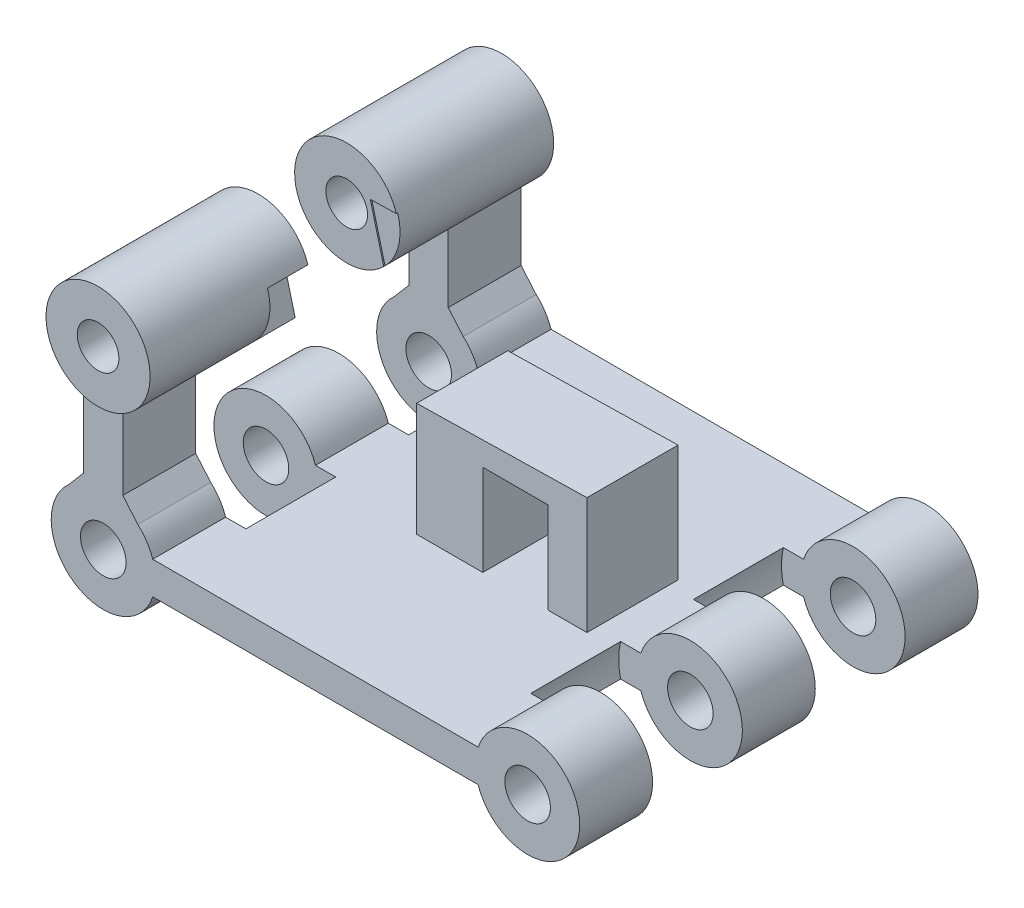
from build123d import *

# Parameters (mm, degrees)
SKETCH_2_R                   = 4
SKETCH_2_R_2                 = 1.75
EXTRUDE_1_DEPTH              = 5.6
PATTERN_LINEAR_1_COUNT       = 3
PATTERN_LINEAR_1_PITCH       = 12.5
EXTRUDE_2_DEPTH              = 6.25
EXTRUDE_2_DEPTH_BACK         = 37.25
SKETCH_3_W                   = 25
SKETCH_3_H                   = 2.5
SKETCH_4_R                   = 5.5
CUT_EXTRUDE_1_DEPTH          = 6.9
PATTERN_LINEAR_2_COUNT       = 4
PATTERN_LINEAR_2_PITCH       = 12.5
PATTERN_LINEAR_4_COUNT       = 2
PATTERN_LINEAR_4_PITCH       = 12.5
PATTERN_START                = 12.5
PATTERN_LINEAR_3_OUTLINE_R   = 1.75
PATTERN_LINEAR_3_DEPTH       = 5.6
PATTERN_START_2              = 25
PATTERN_LINEAR_3_2_OUTLINE_R = 1.75
PATTERN_LINEAR_3_2_DEPTH     = 5.6
MIRROR_3_COPY_1_SKETCH_R     = 5.5
MIRROR_3_COPY_1_DEPTH        = 6.9
MIRROR_3_COPY_2_SKETCH_R     = 5.5
MIRROR_3_COPY_2_DEPTH        = 6.9
MIRROR_3_COPY_3_SKETCH_R     = 5.5
MIRROR_3_COPY_3_DEPTH        = 6.9
MIRROR_3_COPY_4_SKETCH_R     = 5.5
MIRROR_3_COPY_4_DEPTH        = 6.9
SKETCH_5_W                   = 3
SKETCH_5_H                   = 10
EXTRUDE_3_DEPTH              = 5.6
EXTRUDE_4_DEPTH              = 25
EXTRUDE_4_DEPTH_BACK         = 6
SKETCH_6_R                   = 4
SKETCH_7_W                   = 20
SKETCH_7_H                   = 7
EXTRUDE_5_DEPTH              = 10
SKETCH_8_W                   = 5
SKETCH_8_H                   = 7
CUT_EXTRUDE_2_DEPTH          = 10
SKETCH_12_W                  = 25.926545396
SKETCH_12_H                  = 6.65
SKETCH_12_W_2                = 26.106427018
SKETCH_12_H_2                = 6.25
CUT_EXTRUDE_5_DEPTH          = 10
CUT_EXTRUDE_6_DEPTH          = 3.4
CUT_EXTRUDE_6_DEPTH_BACK     = 3.4
SKETCH_13_R                  = 4
SKETCH_14_R                  = 1.6
CUT_EXTRUDE_7_DEPTH          = 56.2


# Read off the part's stored shape, not the designer's step: Линейный массив3
with BuildPart() as part:
    # Эскиз2 → Бобышка-Вытянуть1 (new body)
    with BuildSketch(Plane.XY):
        Circle(SKETCH_2_R)
        Circle(SKETCH_2_R_2, mode=Mode.SUBTRACT)
    extrude_1 = extrude(amount=EXTRUDE_1_DEPTH)


with BuildPart() as pattern_linear_1_1:
    # Линейный массив1: pattern copy
    add(part.part.moved(Location(Vector(0, 0, 1) * (1 * PATTERN_LINEAR_1_PITCH))))


with BuildPart() as pattern_linear_1_2:
    # Линейный массив1: pattern copy
    add(part.part.moved(Location(Vector(0, 0, 1) * (2 * PATTERN_LINEAR_1_PITCH))))


with BuildPart() as part_1:
    add(part.part)

    add(pattern_linear_1_1.part)  # Бобышка-Вытянуть2 merges Линейный массив1_1

    add(pattern_linear_1_2.part)  # Бобышка-Вытянуть2 merges Линейный массив1_2
    # Эскиз3 → Бобышка-Вытянуть2 (add, two sides: drawn at the far end of the back side and taken through both)
    with BuildSketch(Plane(origin=(0, 0, 0), x_dir=(-1, 0, 0), z_dir=(0, 0, -1)).offset(-EXTRUDE_2_DEPTH_BACK)):
        with Locations((16.299671038, 0)):
            Rectangle(SKETCH_3_W, SKETCH_3_H)
    extrude(amount=EXTRUDE_2_DEPTH + EXTRUDE_2_DEPTH_BACK)

    # Эскиз4 → Вырез-Вытянуть1 (cut)
    with BuildSketch(Plane.XY.offset(5.6)):
        Circle(SKETCH_4_R)
    cut_extrude_1 = extrude(amount=CUT_EXTRUDE_1_DEPTH, mode=Mode.SUBTRACT)

    # Линейный массив2: Вырез-Вытянуть1 ×4
    with Locations(*[(0, 0, i * PATTERN_LINEAR_2_PITCH) for i in range(1, PATTERN_LINEAR_2_COUNT)]):
        add(cut_extrude_1, mode=Mode.SUBTRACT)

    # Линейный массив4: Вырез-Вытянуть1 ×2
    with Locations(*[(0, 0, -i * PATTERN_LINEAR_4_PITCH) for i in range(1, PATTERN_LINEAR_4_COUNT)]):
        add(cut_extrude_1, mode=Mode.SUBTRACT)

    # Зеркальное отражение1: Бобышка-Вытянуть1 across plane
    add(extrude_1.mirror(Plane.ZY.offset(16.299671038)))

    # Линейный массив3 outline → Линейный массив3 (add)
    with BuildSketch(Plane.XY.offset(PATTERN_START)):
        with BuildLine():
            ThreePointArc((-28.799671038, 1.25), (-36.599342077, 0), (-28.799671038, -1.25))
            Line((-28.799671038, -1.25), (-28.799671038, 1.25))
        make_face()
        with Locations((-32.599342077, 0)):
            Circle(PATTERN_LINEAR_3_OUTLINE_R, mode=Mode.SUBTRACT)
    extrude(amount=PATTERN_LINEAR_3_DEPTH)

    # Pattern Linear 3 2 outline → Pattern Linear 3 2 (add)
    with BuildSketch(Plane.XY.offset(PATTERN_START_2)):
        with BuildLine():
            ThreePointArc((-28.799671038, 1.25), (-36.599342077, 0), (-28.799671038, -1.25))
            Line((-28.799671038, -1.25), (-28.799671038, 1.25))
        make_face()
        with Locations((-32.599342077, 0)):
            Circle(PATTERN_LINEAR_3_2_OUTLINE_R, mode=Mode.SUBTRACT)
    extrude(amount=PATTERN_LINEAR_3_2_DEPTH)

    # Зеркальное отражение3: Вырез-Вытянуть1 across plane
    add(cut_extrude_1.mirror(Plane.ZY.offset(16.299671038)), mode=Mode.SUBTRACT)

    # Зеркальное отражение3 copy 1 sketch → Зеркальное отражение3 copy 1 (cut)
    with BuildSketch(Plane(origin=(-32.599342077, 0, 18.1), x_dir=(-1, 0, 0), z_dir=(0, 0, 1))):
        Circle(MIRROR_3_COPY_1_SKETCH_R)
    extrude(amount=MIRROR_3_COPY_1_DEPTH, mode=Mode.SUBTRACT)

    # Зеркальное отражение3 copy 2 sketch → Зеркальное отражение3 copy 2 (cut)
    with BuildSketch(Plane(origin=(-32.599342077, 0, 30.6), x_dir=(-1, 0, 0), z_dir=(0, 0, 1))):
        Circle(MIRROR_3_COPY_2_SKETCH_R)
    extrude(amount=MIRROR_3_COPY_2_DEPTH, mode=Mode.SUBTRACT)

    # Зеркальное отражение3 copy 3 sketch → Зеркальное отражение3 copy 3 (cut)
    with BuildSketch(Plane(origin=(-32.599342077, 0, 43.1), x_dir=(-1, 0, 0), z_dir=(0, 0, 1))):
        Circle(MIRROR_3_COPY_3_SKETCH_R)
    extrude(amount=MIRROR_3_COPY_3_DEPTH, mode=Mode.SUBTRACT)

    # Зеркальное отражение3 copy 4 sketch → Зеркальное отражение3 copy 4 (cut)
    with BuildSketch(Plane(origin=(-32.599342077, 0, -6.9), x_dir=(-1, 0, 0), z_dir=(0, 0, 1))):
        Circle(MIRROR_3_COPY_4_SKETCH_R)
    extrude(amount=MIRROR_3_COPY_4_DEPTH, mode=Mode.SUBTRACT)

    # Эскиз5 → Бобышка-Вытянуть3 (add)
    with BuildSketch(Plane(origin=(0, 0, 0), x_dir=(-1, 0, 0), z_dir=(0, 0, -1))):
        with Locations((32.599342077, 8.708099244)):
            Rectangle(SKETCH_5_W, SKETCH_5_H)
    extrude_3 = extrude(amount=-EXTRUDE_3_DEPTH)

    # Зеркальное отражение4: Бобышка-Вытянуть3 across plane
    add(extrude_3.mirror(Plane(origin=(0, 0, 15.3), x_dir=(1, 0, 0), z_dir=(0, 0, -1))))

    # Эскиз6 → Бобышка-Вытянуть4 (add, two sides: drawn at the far end of the back side and taken through both)
    with BuildSketch(Plane(origin=(0, 0, 25), x_dir=(-1, 0, 0), z_dir=(0, 0, -1)).offset(-EXTRUDE_4_DEPTH_BACK)):
        with Locations((32.599342077, 13.708099244)):
            Circle(SKETCH_6_R)
    extrude(amount=EXTRUDE_4_DEPTH + EXTRUDE_4_DEPTH_BACK)

    # Эскиз7 → Бобышка-Вытянуть5 (add)
    with BuildSketch(Plane(origin=(0, 1.25, 0), x_dir=(1, 0, 0), z_dir=(0, 1, 0))):
        with Locations((-17.243270755, -15.3)):
            Rectangle(SKETCH_7_W, SKETCH_7_H)
    extrude(amount=EXTRUDE_5_DEPTH)

    # Эскиз8 → Вырез-Вытянуть2 (cut)
    with BuildSketch(Plane(origin=(0, 0, 11.8), x_dir=(-1, 0, 0), z_dir=(0, 0, -1))):
        Polygon((6.030917846, 10.25), (20.326387044, 9.963182504), (20.326387044, 1.25), (27.243270755, 1.25), (30.785730431, 14.859314756), (3.995086375, 15.396829498), align=None)
        with Locations((12.743270755, 4.75)):
            Rectangle(SKETCH_8_W, SKETCH_8_H)
    extrude(amount=-CUT_EXTRUDE_2_DEPTH, mode=Mode.SUBTRACT)

    # Эскиз12 → Вырез-Вытянуть5 (cut)
    with BuildSketch(Plane(origin=(0, 1.25, 0), x_dir=(1, 0, 0), z_dir=(0, 1, 0))):
        with Locations((-16.867780953, -33.925)):
            Rectangle(SKETCH_12_W, SKETCH_12_H)
        with Locations((-16.852884547, 3.125)):
            Rectangle(SKETCH_12_W_2, SKETCH_12_H_2)
    extrude(amount=-CUT_EXTRUDE_5_DEPTH, mode=Mode.SUBTRACT)

    # Эскиз13 → Вырез-Вытянуть6 (cut, two sides: drawn at the far end of the back side and taken through both)
    with BuildSketch(Plane(origin=(0, 0, 15.3), x_dir=(-1, 0, 0), z_dir=(0, 0, -1)).offset(-CUT_EXTRUDE_6_DEPTH_BACK)):
        with Locations((32.599342077, 13.708099244)):
            Circle(SKETCH_13_R)
    extrude(amount=CUT_EXTRUDE_6_DEPTH + CUT_EXTRUDE_6_DEPTH_BACK, mode=Mode.SUBTRACT)

    # Эскиз14 → Вырез-Вытянуть7 (cut)
    with BuildSketch(Plane(origin=(0, 0, 0), x_dir=(-1, 0, 0), z_dir=(0, 0, -1))):
        with Locations((32.599342077, 13.708099244)):
            Circle(SKETCH_14_R)
    extrude(amount=-CUT_EXTRUDE_7_DEPTH, mode=Mode.SUBTRACT)

    # Фаска1
    # the kernel refuses this chamfer: 1.81151278, 1 mm, written as the material it adds along each edge
    with BuildSketch(Plane(origin=(-31.099342077, 3.708099244, 0), x_dir=(0.8415361936638334, -0.540200735610187, 0), z_dir=(0, 0, 1))) as chamfer_1_piece_1:
        with BuildLine():
            Line((1.429397457, 0), (-0.413759333, 0.557495143))
            Line((-0.413759333, 0.557495143), (-0.444248404, 0.537923532))
            ThreePointArc((-0.444248404, 0.537923532), (-0.217578261, 0.271879907), (-0.030489071, -0.019571611))
            Line((-0.030489071, -0.019571611), (0.006709967, -0.03560348))
            ThreePointArc((0.006709967, -0.03560348), (0.714480275, 0.032881444), (1.423788773, -0.035793492))
            Line((1.423788773, -0.035793492), (1.429397457, 0))
        make_face()
    extrude(amount=5.6)
    with BuildSketch(Plane(origin=(-34.099342077, 3.708099244, 0), x_dir=(-0.8415361936638353, -0.5402007356101841, 0), z_dir=(0, 0, 1))) as chamfer_1_piece_2:
        with BuildLine():
            Line((1.429397457, 0), (-0.413759333, -0.557495143))
            Line((-0.413759333, -0.557495143), (-0.444248404, -0.537923532))
            ThreePointArc((-0.444248404, -0.537923532), (-0.217578261, -0.271879907), (-0.030489071, 0.019571611))
            Line((-0.030489071, 0.019571611), (0.006709967, 0.03560348))
            ThreePointArc((0.006709967, 0.03560348), (0.714480275, -0.032881444), (1.423788773, 0.035793492))
            Line((1.423788773, 0.035793492), (1.429397457, 0))
        make_face()
    extrude(amount=5.6)
    with BuildSketch(Plane(origin=(-31.099342077, 3.708099244, 30.6), x_dir=(0.8415361938100423, -0.5402007353824197, 0), z_dir=(0, 0, -1))) as chamfer_1_piece_3:
        with BuildLine():
            Line((1.429397457, 0), (-0.413759333, -0.557495144))
            Line((-0.413759333, -0.557495144), (-0.444248404, -0.537923533))
            ThreePointArc((-0.444248404, -0.537923533), (-0.217578261, -0.271879907), (-0.030489071, 0.019571611))
            Line((-0.030489071, 0.019571611), (0.006709967, 0.03560348))
            ThreePointArc((0.006709967, 0.03560348), (0.714480275, -0.032881444), (1.423788773, 0.035793492))
            Line((1.423788773, 0.035793492), (1.429397457, 0))
        make_face()
    extrude(amount=5.6)
    with BuildSketch(Plane(origin=(-34.099342077, 3.708099244, 30.6), x_dir=(-0.8415361937600511, -0.5402007354602969, 0), z_dir=(0, 0, -1))) as chamfer_1_piece_4:
        with BuildLine():
            Line((1.429397457, 0), (-0.413759333, 0.557495144))
            Line((-0.413759333, 0.557495144), (-0.444248404, 0.537923533))
            ThreePointArc((-0.444248404, 0.537923533), (-0.217578261, 0.271879907), (-0.030489071, -0.019571611))
            Line((-0.030489071, -0.019571611), (0.006709967, -0.03560348))
            ThreePointArc((0.006709967, -0.03560348), (0.714480275, 0.032881444), (1.423788773, -0.035793492))
            Line((1.423788773, -0.035793492), (1.429397457, 0))
        make_face()
    extrude(amount=5.6)


solid = part_1.part
